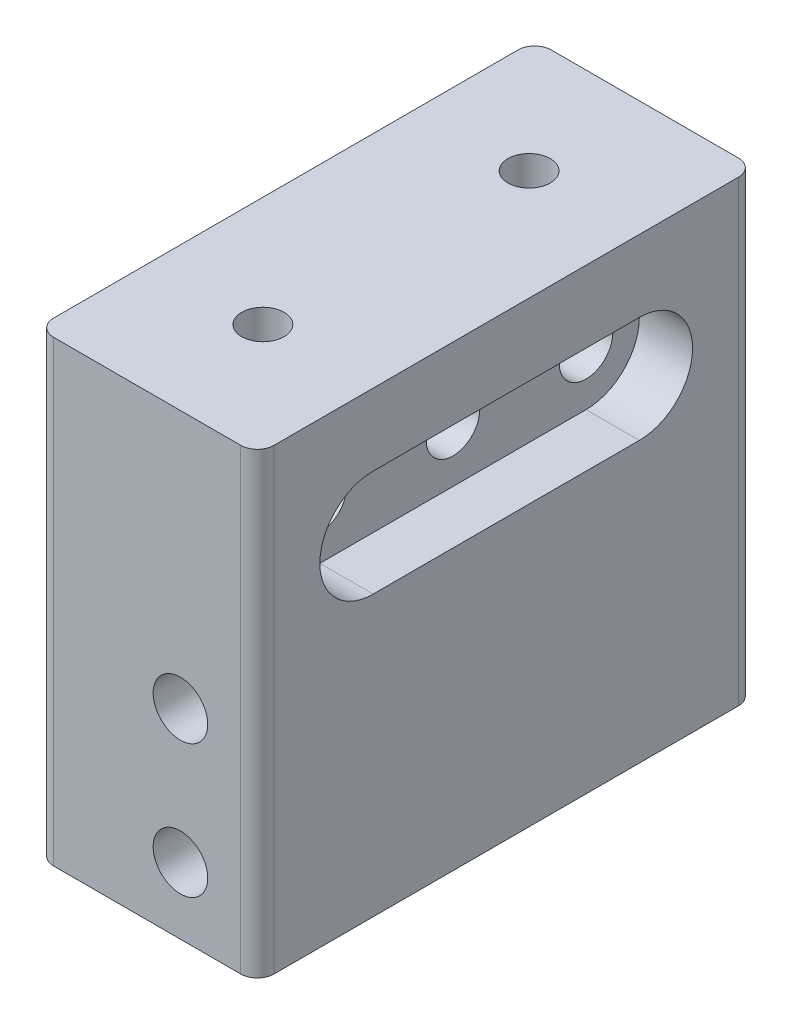
from build123d import *

# Parameters (mm, degrees)
SKETCH1_W           = 21.0312
SKETCH1_H           = 47.4853
BOSS_EXTRUDE1_DEPTH = 19.05
SKETCH2_R           = 2.6035
CUT_EXTRUDE1_DEPTH  = 53.23345728
SKETCH4_R           = 2.5527
CUT_EXTRUDE3_DEPTH  = 37.999017588
FILLET1_R           = 1.5875
CUT_EXTRUDE5_DEPTH  = 5.08
BOSS_EXTRUDE2_DEPTH = 5.588
SKETCH9_R           = 2.0193
CUT_EXTRUDE6_DEPTH  = 5.08


with BuildPart() as part:
    # Sketch1 → Boss-Extrude1 (new, symmetric)
    with BuildSketch(Plane(origin=(0, 0, 0), x_dir=(1, 0, 0), z_dir=(0, 1, 0))):
        Rectangle(SKETCH1_W, SKETCH1_H)
    extrude(amount=BOSS_EXTRUDE1_DEPTH, both=True)

    # Sketch2 → Cut-Extrude1 (cut, through all)
    with BuildSketch(Plane.XY.offset(23.74265)):
        with Locations((3.175, -12.7)):
            Circle(SKETCH2_R)
        with Locations((3.175, 0)):
            Circle(SKETCH2_R)
    extrude(amount=-CUT_EXTRUDE1_DEPTH, mode=Mode.SUBTRACT)

    # Sketch4 → Cut-Extrude3 (cut, through all)
    with BuildSketch(Plane(origin=(10.5156, 0, 0), x_dir=(0, 0, -1), z_dir=(1, 0, 0))):
        with Locations((-12.7, 12.7)):
            Circle(SKETCH4_R)
        with Locations((12.7, 12.7)):
            Circle(SKETCH4_R)
        with Locations((0, 12.7)):
            Circle(SKETCH4_R)
    extrude(amount=-CUT_EXTRUDE3_DEPTH, mode=Mode.SUBTRACT)

    # Fillet1
    fillet1_edges = [part.edges().sort_by_distance(p)[0] for p in [
        (10.5156, 0, 23.74265),
        (-10.5156, 0, 23.74265),
        (-10.5156, 0, -23.74265),
        (10.5156, 0, -23.74265),
    ]]
    fillet(fillet1_edges, radius=FILLET1_R)

    # Sketch7 → Cut-Extrude5 (cut)
    with BuildSketch(Plane(origin=(10.5156, 0, 0), x_dir=(0, 0, -1), z_dir=(1, 0, 0))):
        with BuildLine():
            Line((-12.7, 17.78), (12.7, 17.78))
            ThreePointArc((12.7, 17.78), (17.78, 12.7), (12.7, 7.62))
            Line((12.7, 7.62), (-12.7, 7.62))
            ThreePointArc((-12.7, 7.62), (-17.78, 12.7), (-12.7, 17.78))
        make_face()
    extrude(amount=-CUT_EXTRUDE5_DEPTH, mode=Mode.SUBTRACT)

    # Sketch8 → Boss-Extrude2 (add)
    with BuildSketch(Plane(origin=(0, 19.05, 0), x_dir=(1, 0, 0), z_dir=(0, 1, 0))):
        with BuildLine():
            Line((-8.9281, -23.74265), (8.9281, -23.74265))
            ThreePointArc((8.9281, -23.74265), (10.050632015, -23.277682015), (10.5156, -22.15515))
            Line((10.5156, -22.15515), (10.5156, 22.15515))
            ThreePointArc((10.5156, 22.15515), (10.050632015, 23.277682015), (8.9281, 23.74265))
            Line((8.9281, 23.74265), (-8.9281, 23.74265))
            ThreePointArc((-8.9281, 23.74265), (-10.050632015, 23.277682015), (-10.5156, 22.15515))
            Line((-10.5156, 22.15515), (-10.5156, -22.15515))
            ThreePointArc((-10.5156, -22.15515), (-10.050632015, -23.277682015), (-8.9281, -23.74265))
        make_face()
    extrude(amount=BOSS_EXTRUDE2_DEPTH)

    # Sketch9 → Cut-Extrude6 (cut)
    with BuildSketch(Plane(origin=(0, 24.638, 0), x_dir=(1, 0, 0), z_dir=(0, 1, 0))):
        with Locations((0, 12.7)):
            Circle(SKETCH9_R)
        with Locations((0, -12.7)):
            Circle(SKETCH9_R)
    extrude(amount=-CUT_EXTRUDE6_DEPTH, mode=Mode.SUBTRACT)


solid = part.part
